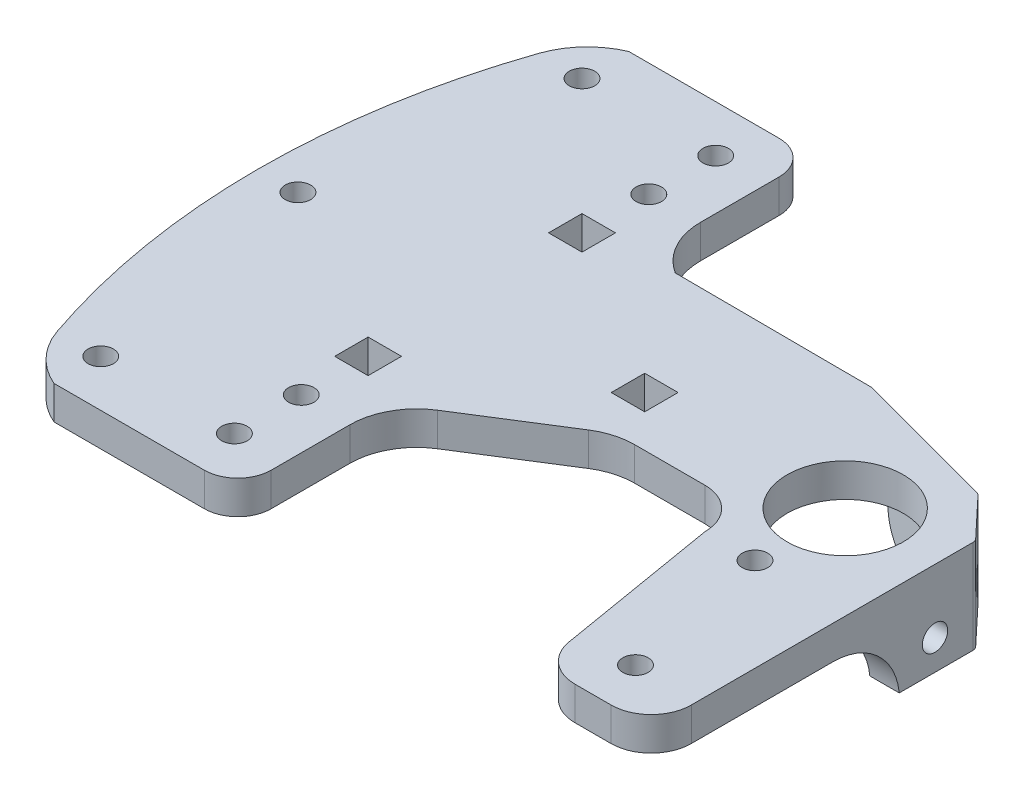
from build123d import *

# Parameters (mm, degrees)
SKETCH1_R           = 2.413
SKETCH1_W           = 6.35
SKETCH1_H           = 6.35
SKETCH1_R_2         = 11.049
BOSS_EXTRUDE1_DEPTH = 6.35
BOSS_EXTRUDE4_DEPTH = 11.43
SKETCH7_R           = 2.413
CUT_EXTRUDE4_DEPTH  = 11.43
SKETCH8_R           = 2.413
CUT_EXTRUDE5_DEPTH  = 11.43
BOSS_EXTRUDE5_DEPTH = 11.43
SKETCH14_R          = 2.3114
CUT_EXTRUDE8_DEPTH  = 21.844
CUT_EXTRUDE9_DEPTH  = 21.844
FILLET3_R           = 1.27
FILLET4_R           = 5.08
FILLET5_R           = 7.62
FILLET6_START       = 3.433618276
FILLET6_DEPTH       = 6.8580001
FILLET6_START_2     = -2.219498454
FILLET6_2_DEPTH     = 12.636340452


with BuildPart() as part:
    # Sketch1 → Boss-Extrude1 (new body)
    with BuildSketch(Plane(origin=(0, 0, 0), x_dir=(1, 0, 0), z_dir=(0, 1, 0))):
        with BuildLine():
            ThreePointArc((-44.712520386, -1.790319958), (-41.464378908, -0.332372105), (-37.939187052, 0.166684391))
            Line((-37.939187052, 0.166684391), (-27.387614836, 0.166684391))
            Line((-27.387614836, 0.166684391), (-24.553673229, 0.166684391))
            ThreePointArc((-24.553673229, 0.166684391), (-19.165519557, -2.065161936), (-16.933673229, -7.453315609))
            Line((-16.933673229, -7.453315609), (-11.696120928, -38.563381903))
            ThreePointArc((-11.696120928, -38.563381903), (-9.102466616, -43.116571583), (-4.181867321, -44.918315609))
            Line((-4.181867321, -44.918315609), (2.671618376, -44.918315609))
            ThreePointArc((2.671618376, -44.918315609), (8.059772048, -42.686469281), (10.291618376, -37.298315609))
            Line((10.291618376, -37.298315609), (10.291618376, -36.576031258))
            Line((10.291618376, -36.576031258), (10.291618376, 31.928258006))
            Line((10.291618376, 31.928258006), (-62.328552859, 32.280391547))
            ThreePointArc((-62.328552859, 32.280391547), (-66.67527648, 36.888704376), (-68.255219526, 43.023387198))
            Line((-68.255219526, 43.023387198), (-68.255219526, 57.951684391))
            ThreePointArc((-68.255219526, 57.951684391), (-70.115091465, 62.441812452), (-74.605219526, 64.301684391))
            Line((-74.605219526, 64.301684391), (-103.180219526, 64.301684391))
            ThreePointArc((-103.180219526, 64.301684391), (-108.250679153, 60.73228976), (-111.435219526, 55.411684391))
            ThreePointArc((-111.435219526, 55.411684391), (-119.055219526, 9.691684391), (-111.435219526, -36.028315609))
            ThreePointArc((-111.435219526, -36.028315609), (-108.250679153, -41.348920977), (-103.180219526, -44.918315609))
            Line((-103.180219526, -44.918315609), (-74.605219526, -44.918315609))
            ThreePointArc((-74.605219526, -44.918315609), (-70.115091465, -43.058443669), (-68.255219526, -38.568315609))
            Line((-68.255219526, -38.568315609), (-68.255219526, -23.640018416))
            ThreePointArc((-68.255219526, -23.640018416), (-66.67527648, -17.505335593), (-62.328552859, -12.897022765))
            Line((-62.328552859, -12.897022765), (-44.712520386, -1.790319958))
        make_face()
        with Locations(Location((-103.180219526, -36.028315609, 0), (0, 0, 270))):
            Circle(SKETCH1_R, mode=Mode.SUBTRACT)
        with Locations(Location((-77.780219526, -36.028315609, 0), (0, 0, 270))):
            Circle(SKETCH1_R, mode=Mode.SUBTRACT)
        with Locations(Location((-77.780219526, -23.328315609, 0), (0, 0, 270))):
            Circle(SKETCH1_R, mode=Mode.SUBTRACT)
        with Locations((-77.780219526, -10.628315609)):
            Rectangle(SKETCH1_W, SKETCH1_H, mode=Mode.SUBTRACT)
        with Locations(Location((-1.580219526, -36.028315609, 0), (0, 0, 270))):
            Circle(SKETCH1_R, mode=Mode.SUBTRACT)
        with Locations(Location((-7.451232573, -7.453315609, 0), (0, 0, 270))):
            Circle(SKETCH1_R, mode=Mode.SUBTRACT)
        with Locations(Location((-111.435219526, 9.691684391, 0), (0, 0, 270))):
            Circle(SKETCH1_R, mode=Mode.SUBTRACT)
        with Locations((-77.780219526, 30.011684391)):
            Rectangle(SKETCH1_W, SKETCH1_H, mode=Mode.SUBTRACT)
        with Locations(Location((-103.180219526, 55.411684391, 0), (0, 0, 270))):
            Circle(SKETCH1_R, mode=Mode.SUBTRACT)
        with Locations(Location((-77.780219526, 42.711684391, 0), (0, 0, 270))):
            Circle(SKETCH1_R, mode=Mode.SUBTRACT)
        with Locations(Location((-77.780219526, 55.411684391, 0), (0, 0, 270))):
            Circle(SKETCH1_R, mode=Mode.SUBTRACT)
        with Locations((-45.551232573, 9.691684391)):
            Rectangle(SKETCH1_W, SKETCH1_H, mode=Mode.SUBTRACT)
        with Locations(Location((-7.451232573, 9.691684391, 0), (0, 0, 270))):
            Circle(SKETCH1_R_2, mode=Mode.SUBTRACT)
    extrude(amount=BOSS_EXTRUDE1_DEPTH)



with BuildPart() as body_2:
    # Sketch6 → Boss-Extrude4 (new body)
    with BuildSketch(Plane.XZ):
        Polygon((10.291618376, -2.219498454), (10.291618376, -16.715666773), (2.76121074, -24.725802919), (-1.31013754, -20.898288428), (4.703618376, -14.501423083), (4.703618376, -2.219498454), align=None)
    extrude(amount=BOSS_EXTRUDE4_DEPTH)

    # Sketch7 → Cut-Extrude4 (cut)
    with BuildSketch(Plane(origin=(13.805123423, 0, -12.978332071), x_dir=(-0.6849524859235093, 0, -0.7285877380434048), z_dir=(0.7285877380434048, 0, -0.6849524859235093))):
        with Locations((12.749560253, -5.715)):
            Circle(SKETCH7_R)
    extrude(amount=-CUT_EXTRUDE4_DEPTH, mode=Mode.SUBTRACT)

    # Sketch8 → Cut-Extrude5 (cut)
    with BuildSketch(Plane(origin=(10.291618376, 0, 0), x_dir=(0, 0, -1), z_dir=(1, 0, 0))):
        with Locations((9.007351169, -5.715)):
            Circle(SKETCH8_R)
    extrude(amount=-CUT_EXTRUDE5_DEPTH, mode=Mode.SUBTRACT)


with BuildPart() as part_1:
    add(part.part)

    add(body_2.part)  # Boss-Extrude5 merges body 2
    # Sketch13 → Boss-Extrude5 (add)
    with BuildSketch(Plane.XZ):
        Polygon((2.76121074, -24.725802919), (-12.621219973, -28.847512806), (-13.850827217, -24.258556099), (-1.31013754, -20.898288428), align=None)
    extrude(amount=BOSS_EXTRUDE5_DEPTH)

    # Sketch14 → Cut-Extrude8 (cut)
    with BuildSketch(Plane(origin=(6.366416777, 0, -23.759790873), x_dir=(-0.9659258262890685, 0, -0.2588190451025197), z_dir=(0.2588190451025197, 0, -0.9659258262890685))):
        with Locations((10.082383935, -5.719726248)):
            Circle(SKETCH14_R)
    extrude(amount=-CUT_EXTRUDE8_DEPTH, mode=Mode.SUBTRACT)

    # Sketch15 → Cut-Extrude9 (cut)
    with BuildSketch(Plane.XZ):
        Polygon((10.291618376, -16.715666773), (2.76121074, -24.725802919), (-24.752905313, -32.098188096), (10.291618376, -31.928258006), align=None)
    extrude(amount=-CUT_EXTRUDE9_DEPTH, mode=Mode.SUBTRACT)

    # Fillet3
    fillet3_edges = [part_1.edges().sort_by_distance(p)[0] for p in [
        (2.76121074, -2.54, -24.725802919),
        (-1.31013754, -5.715, -20.898288428),
        (-7.580482379, 0, -22.578422263),
        (4.703618376, 0, -8.360460768),
        (1.696740418, 0, -17.699855755),
        (4.703618376, -5.715, -14.501423083),
        (10.291618376, -2.54, -16.715666773),
    ]]
    fillet(fillet3_edges, radius=FILLET3_R)

    # Fillet4
    fillet4_edges = [part_1.edges().sort_by_distance(p)[0] for p in [
        (-13.400373689, 0, -25.939671553),
    ]]
    fillet(fillet4_edges, radius=FILLET4_R)

    # Fillet5
    fillet5_edges = [part_1.edges().sort_by_distance(p)[0] for p in [
        (-13.236023595, -11.43, -26.553034453),
    ]]
    fillet(fillet5_edges, radius=FILLET5_R)

    # Fillet6: read off the stored shape, not the designer's step
    # Fillet6 outline → Fillet6 (add)
    with BuildSketch(Plane.YZ.offset(FILLET6_START)):
        with BuildLine():
            Line((0, -2.219498454), (0, 10.416841998))
            ThreePointArc((0, 10.416841998), (-3.281427921, 1.897423003), (-11.43, -2.219498454))
            Line((-11.43, -2.219498454), (0, -2.219498454))
        make_face()
    extrude(amount=FILLET6_DEPTH)

    # Fillet6 2 outline → Fillet6 2 (cut)
    with BuildSketch(Plane.XY.offset(FILLET6_START_2)):
        with BuildLine():
            Line((4.703618377, -13), (4.703573688, -1.259346045))
            ThreePointArc((4.703573688, -1.259346045), (4.327869313, -0.368215513), (3.433618376, 0))
            Line((3.433618376, 0), (3.433618276, -13))
            Line((3.433618276, -13), (4.703618377, -13))
        make_face()
    extrude(amount=FILLET6_2_DEPTH, mode=Mode.SUBTRACT)


solid = part_1.part
